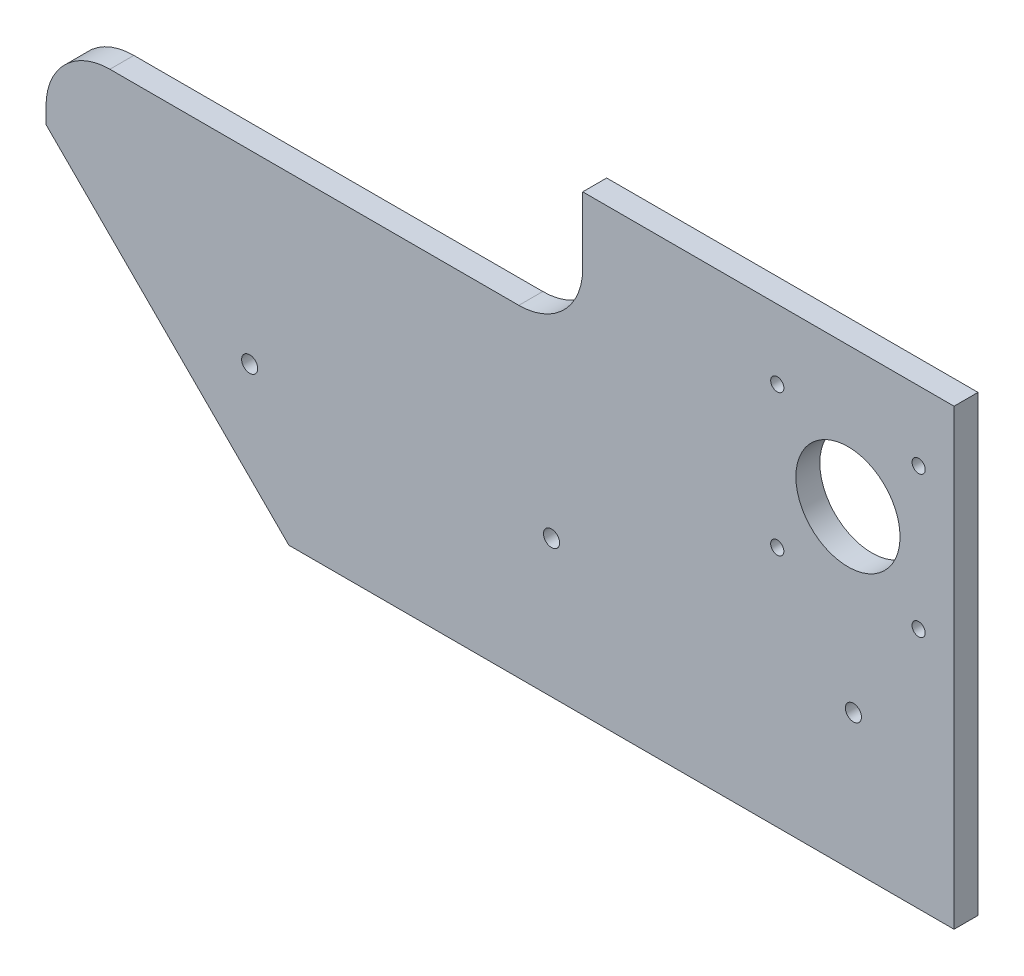
from build123d import *

# Parameters (mm, degrees)
SKETCH1_R                    = 20.701
BOSS_EXTRUDE1_DEPTH          = 9.525
SKETCH2_W                    = 285.57287806
SKETCH2_H                    = 73.914
CUT_EXTRUDE1_DEPTH           = 267.58430025
SKETCH4_W                    = 213.36
SKETCH4_H                    = 65.465352004
CUT_EXTRUDE2_DEPTH           = 267.58430025
FILLET2_R                    = 25.4
F_6_4_6_4_DIAMETER_HOLE2_D   = 6.4
SKETCH16_W                   = 9.525
SKETCH16_H                   = 0.985363282
CUT_EXTRUDE3_DEPTH           = 390.572219806
SKETCH17_W                   = 147.610011278
SKETCH17_H                   = 12.7
CUT_EXTRUDE4_DEPTH           = 267.045158533
TAP_DRILL_FOR_M6X0_75_TAP1_D = 5.25


with BuildPart() as part:
    # Sketch1 → Boss-Extrude1 (new body)
    with BuildSketch(Plane.XY):
        Polygon((-138.259383474, 48.991487021), (32.210627804, -121.478524257), (222.710627804, -121.478524257), (222.710627804, 146.206839025), (-138.259383474, 146.206839025), align=None)
        with Locations((180.538014078, 76.831975743)):
            Circle(SKETCH1_R, mode=Mode.SUBTRACT)
    extrude(amount=BOSS_EXTRUDE1_DEPTH)

    # Sketch2 → Cut-Extrude1 (cut, through all)
    with BuildSketch(Plane.XY.offset(9.525)):
        with Locations((98.974188774, -84.521524257)):
            Rectangle(SKETCH2_W, SKETCH2_H)
    extrude(amount=-CUT_EXTRUDE1_DEPTH, mode=Mode.SUBTRACT)

    # Sketch4 → Cut-Extrude2 (cut, through all)
    with BuildSketch(Plane.XY.offset(9.525)):
        with Locations((-31.579383474, 113.474163023)):
            Rectangle(SKETCH4_W, SKETCH4_H)
    extrude(amount=-CUT_EXTRUDE2_DEPTH, mode=Mode.SUBTRACT)

    # Fillet2
    fillet2_edges = [part.edges().sort_by_distance(p)[0] for p in [
        (-138.259383474, 80.741487021, 4.7625),
        (75.100616526, 80.741487021, 4.7625),
    ]]
    fillet(fillet2_edges, radius=FILLET2_R)

    # Ø6.4 (6.4) Diameter Hole2 (through all)
    with Locations(Plane(origin=(0, 0, 0), x_dir=(-1, 0, 0), z_dir=(0, 0, -1))):
        with Locations((-182.710627794, 7.042935743), (-62.710627794, 7.042935743), (57.289372206, 7.042935743)):
            Hole(F_6_4_6_4_DIAMETER_HOLE2_D / 2)

    # Sketch16 → Cut-Extrude3 (cut, through all)
    with BuildSketch(Plane(origin=(222.710627804, 0, 0), x_dir=(0, 0, -1), z_dir=(1, 0, 0))):
        with Locations((-4.7625, 145.714157384)):
            Rectangle(SKETCH16_W, SKETCH16_H)
    extrude(amount=-CUT_EXTRUDE3_DEPTH, mode=Mode.SUBTRACT)

    # Sketch17 → Cut-Extrude4 (cut, through all)
    with BuildSketch(Plane(origin=(0, 0, 0), x_dir=(-1, 0, 0), z_dir=(0, 0, -1))):
        with Locations((-148.905622165, 138.871475743)):
            Rectangle(SKETCH17_W, SKETCH17_H)
    extrude(amount=-CUT_EXTRUDE4_DEPTH, mode=Mode.SUBTRACT)

    # Tap Drill for M6x0.75 Tap1 (through all)
    with Locations(Plane.XY.offset(9.525)):
        with Locations((208.638014078, 104.931975743), (152.438014078, 104.931975743), (152.438014078, 48.731975743), (208.638014078, 48.731975743)):
            Hole(TAP_DRILL_FOR_M6X0_75_TAP1_D / 2)


solid = part.part
